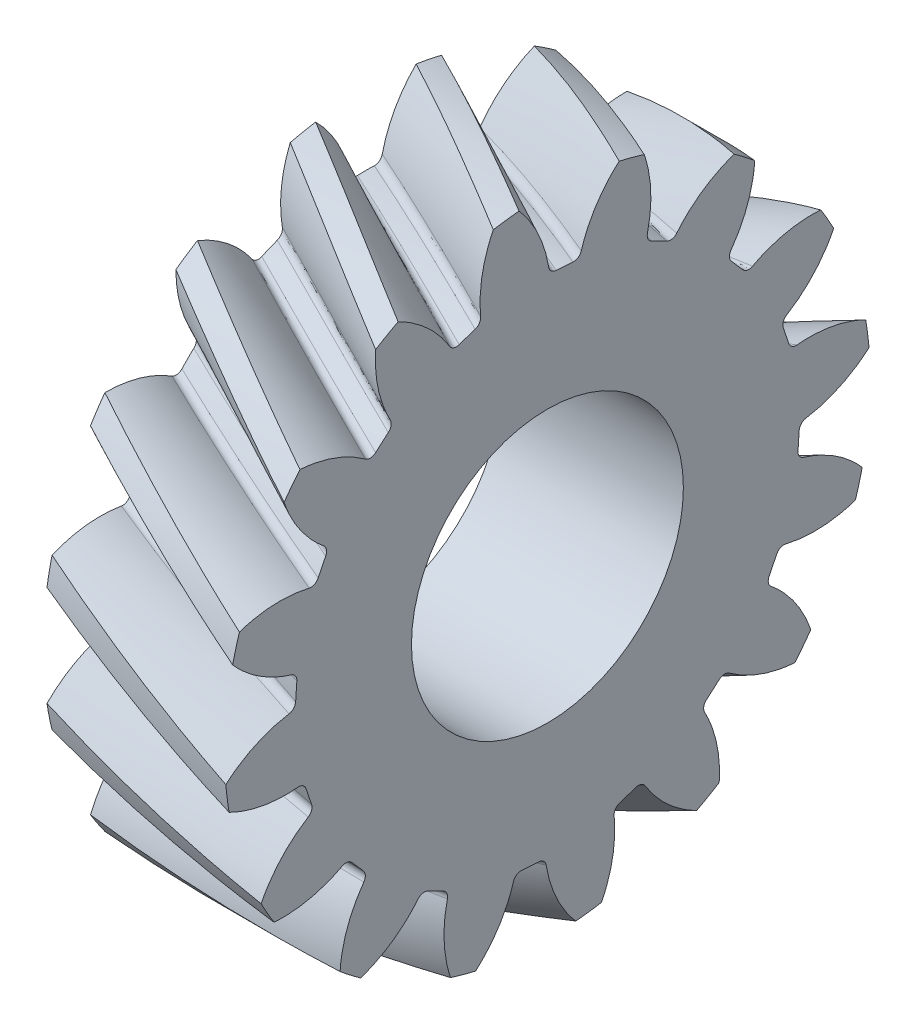
from build123d import *

# Parameters (mm, degrees)
BASPROSKE_W            = 6.475
BASPROSKE_H            = 11.517304845
TOOTHCUTRH_PITCH       = 125.340481238
TOOTHCUTRH_HEIGHT      = 6.475
TOOTHCUTRH_RADIUS      = 11.517304845
TOOTHCUTRH_START_ANGLE = -90
TEETHCUTSRH_COUNT      = 16
TEETHCUTSRH_ANGLE      = 337.5
BORSKE_R               = 7.780151776
BORE_DEPTH             = 62.5000025
SKETCH3_R              = 7.780151776
SKETCH3_R_2            = 4.85
BOSS_EXTRUDE1_DEPTH    = 6.475


with BuildPart() as part:
    # BasProSke → Base-Revolve (revolve)
    with BuildSketch(Plane(origin=(0, 0, 0), x_dir=(1, 0, 0), z_dir=(0, 1, 0)), mode=Mode.PRIVATE) as base_revolve_sk:
        with Locations((3.2375, 5.758652422)):
            Rectangle(BASPROSKE_W, BASPROSKE_H)
    revolve(base_revolve_sk.sketch.rotate(Axis((-10, 0, 0), (1, 0, 0)), 180), axis=Axis((-10, 0, 0), (1, 0, 0)))

    # ToothCutRH: sweep along a helix
    with BuildLine() as toothcutrh_path:
        add(Helix(TOOTHCUTRH_PITCH, TOOTHCUTRH_HEIGHT, TOOTHCUTRH_RADIUS, center=(0, 0, 0), direction=(1, 0, 0), mode=Mode.PRIVATE).rotate(Axis((0, 0, 0), (1, 0, 0)), TOOTHCUTRH_START_ANGLE))
    # TooCutSkeRH → ToothCutRH (sweep, cut)
    with BuildSketch(Plane(origin=(0, 0, 0), x_dir=(0, 0, -1), z_dir=(1, 0, 0))):
        with BuildLine():
            ThreePointArc((0.299456968, 8.981063813), (0, 8.986054845), (-0.299456968, 8.981063813))
            ThreePointArc((-0.299456968, 8.981063813), (-0.480949156, 9.039435424), (-0.5839281, 9.19987855))
            ThreePointArc((-0.5839281, 9.19987855), (-1.145572372, 10.563455562), (-2.117881545, 11.672239322))
            ThreePointArc((-2.117881545, 11.672239322), (0, 11.862823991), (2.117881545, 11.672239322))
            ThreePointArc((2.117881545, 11.672239322), (1.145572372, 10.563455562), (0.5839281, 9.19987855))
            ThreePointArc((0.5839281, 9.19987855), (0.480949156, 9.039435424), (0.299456968, 8.981063813))
        make_face()
    toothcutrh = sweep(path=toothcutrh_path.line, is_frenet=True, mode=Mode.SUBTRACT)

    # TeethCutsRH: ToothCutRH ×16 about axis
    teethcutsrh_axis = Axis((-10, 0, 0), (1, 0, 0))
    for i in range(1, TEETHCUTSRH_COUNT):
        add(toothcutrh.rotate(teethcutsrh_axis, i * TEETHCUTSRH_ANGLE / (TEETHCUTSRH_COUNT - 1)), mode=Mode.SUBTRACT)

    # BorSke → Bore (cut, symmetric)
    with BuildSketch(Plane(origin=(0, 0, 0), x_dir=(0, 0, -1), z_dir=(1, 0, 0))):
        with Locations(Location((0, 0, 0), (0, 0, 180))):
            Circle(BORSKE_R)
    extrude(amount=BORE_DEPTH, both=True, mode=Mode.SUBTRACT)

    # Sketch3 → Boss-Extrude1 (add)
    with BuildSketch(Plane(origin=(6.475, 0, 0), x_dir=(0, 0, -1), z_dir=(1, 0, 0))):
        Circle(SKETCH3_R)
        Circle(SKETCH3_R_2, mode=Mode.SUBTRACT)
    extrude(amount=-BOSS_EXTRUDE1_DEPTH)


solid = part.part
